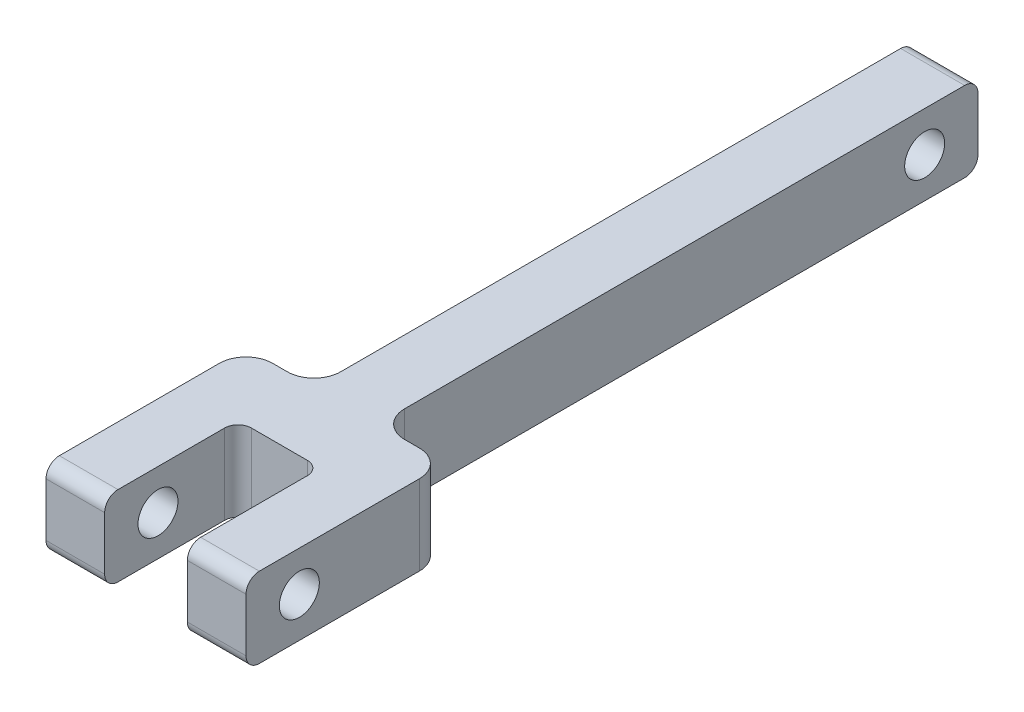
from build123d import *
from build123d.topology import SkipClean

# Parameters (mm, degrees)
SALIENTE_EXTRUIR1_DEPTH    = 2.4
CORTAR_EXTRUIR1_DEPTH      = 31.244999587
CORTAR_EXTRUIR1_DEPTH_BACK = 31.244999587
CROQUIS2_R                 = 1.5
CROQUIS3_R                 = 1.5
SALIENTE_EXTRUIR2_DEPTH    = 7.5
CORTAR_EXTRUIR2_DEPTH      = 3.1
REDONDEO1_R                = 2
REDONDEO2_R                = 1


with BuildPart() as part:
    # Croquis1 → Saliente-Extruir1 (new, symmetric)
    with BuildSketch(Plane(origin=(0, 0, 0), x_dir=(0, 0, -1), z_dir=(1, 0, 0))):
        with BuildLine():
            Line((-29, 3), (29, 3))
            ThreePointArc((29, 3), (29.707106781, 2.707106781), (30, 2))
            Line((30, 2), (30, -2))
            ThreePointArc((30, -2), (29.707106781, -2.707106781), (29, -3))
            Line((29, -3), (-29, -3))
            ThreePointArc((-29, -3), (-29.707106781, -2.707106781), (-30, -2))
            Line((-30, -2), (-30, 2))
            ThreePointArc((-30, 2), (-29.707106781, 2.707106781), (-29, 3))
        make_face()
    extrude(amount=SALIENTE_EXTRUIR1_DEPTH, both=True)

    # Croquis2 → Cortar-Extruir1 (cut, two sides: drawn at the far end of the back side and taken through both)
    with BuildSketch(Plane(origin=(0, 0, 0), x_dir=(0, 0, -1), z_dir=(1, 0, 0)).offset(-CORTAR_EXTRUIR1_DEPTH_BACK)):
        with Locations((-26, 0)):
            Circle(CROQUIS2_R)
        with Locations((26, 0)):
            Circle(CROQUIS2_R)
    extrude(amount=CORTAR_EXTRUIR1_DEPTH + CORTAR_EXTRUIR1_DEPTH_BACK, mode=Mode.SUBTRACT)

    # Croquis3 → Saliente-Extruir2 (add, symmetric)
    with SkipClean():  # the faces are left unmerged after this step: merging them gives an invalid solid
        with BuildSketch(Plane(origin=(0, 0, 0), x_dir=(0, 0, -1), z_dir=(1, 0, 0))):
            with BuildLine():
                Line((-30, 2), (-30, -2))
                ThreePointArc((-30, -2), (-29.707106781, -2.707106781), (-29, -3))
                Line((-29, -3), (-15, -3))
                Line((-15, -3), (-15, 3))
                Line((-15, 3), (-29, 3))
                ThreePointArc((-29, 3), (-29.707106781, 2.707106781), (-30, 2))
            make_face()
            with Locations((-26, 0)):
                Circle(CROQUIS3_R, mode=Mode.SUBTRACT)
        extrude(amount=SALIENTE_EXTRUIR2_DEPTH, both=True)
    add(part.part.scale(1), mode=Mode.REPLACE)  # the faces are merged on a copy

    # Croquis4 → Cortar-Extruir2 (cut, symmetric)
    with BuildSketch(Plane(origin=(0, 0, 0), x_dir=(0, 0, -1), z_dir=(1, 0, 0))):
        with BuildLine():
            Line((-29, 3), (-20, 3))
            Line((-20, 3), (-20, -3))
            Line((-20, -3), (-29, -3))
            ThreePointArc((-29, -3), (-29.707106781, -2.707106781), (-30, -2))
            Line((-30, -2), (-30, 2))
            ThreePointArc((-30, 2), (-29.707106781, 2.707106781), (-29, 3))
        make_face()
    extrude(amount=CORTAR_EXTRUIR2_DEPTH, both=True, mode=Mode.SUBTRACT)

    # Redondeo1
    redondeo1_edges = [part.edges().sort_by_distance(p)[0] for p in [
        (2.4, 0, 15),
        (-2.4, 0, 15),
        (7.5, 0, 15),
        (-7.5, 0, 15),
    ]]
    fillet(redondeo1_edges, radius=REDONDEO1_R)

    # Redondeo2
    redondeo2_edges = [part.edges().sort_by_distance(p)[0] for p in [
        (3.1, 0, 20),
        (-3.1, 0, 20),
    ]]
    fillet(redondeo2_edges, radius=REDONDEO2_R)


solid = part.part
